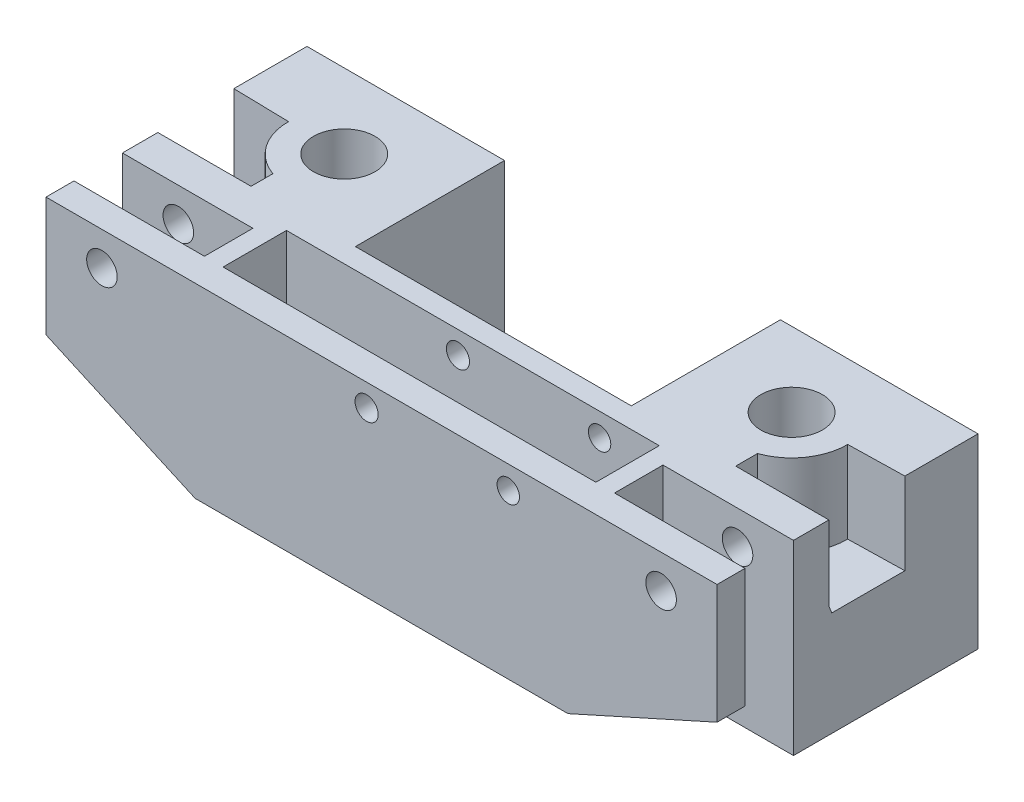
from build123d import *

# Parameters (mm, degrees)
SKETCH1_R               = 2.51
BOSS_EXTRUDE1_DEPTH     = 5
SKETCH2_R               = 6.125
SKETCH2_R_2             = 4.125
BOSS_EXTRUDE2_DEPTH     = 20
SKETCH1_3_W             = 20
SKETCH1_3_H             = 15
BOSS_EXTRUDE3_DEPTH     = 25
SKETCH3_W               = 17.5
SKETCH3_H               = 6.5
CUT_EXTRUDE2_DEPTH      = 21.5
CUT_EXTRUDE3_REACH      = 64.249
SKETCH4_R               = 2.05
SKETCH5_W               = 13.25
SKETCH5_H               = 9
CUT_EXTRUDE4_DEPTH      = 97.695397829
BOSS_EXTRUDE4_DEPTH     = 90
SKETCH9_R               = 1.5
CUT_EXTRUDE6_DEPTH      = 56.226804735
BOSS_EXTRUDE9_OUTLINE_W = 26.5
BOSS_EXTRUDE9_OUTLINE_H = 20
BOSS_EXTRUDE9_OUTLINE_R = 6.125
BOSS_EXTRUDE9_DEPTH     = 9
SKETCH12_R              = 7.5
SKETCH12_R_2            = 6.125
SKETCH12_W              = 5
SKETCH12_H              = 0.387499923
BOSS_EXTRUDE10_DEPTH    = 11
BOSS_EXTRUDE11_START    = -25
SKETCH13_W              = 50
SKETCH13_H              = 3.75
BOSS_EXTRUDE11_DEPTH    = 25
BOSS_EXTRUDE12_DEPTH    = 9
BOSS_EXTRUDE13_DEPTH    = 3.75
SKETCH16_R              = 1.55
SKETCH16_R_2            = 1.5
CUT_EXTRUDE7_DEPTH      = 38


# Read off the part's stored shape, not the designer's step: Boss-Extrude9
with BuildPart() as part:
    # Sketch1 → Boss-Extrude1 (new body)
    with BuildSketch(Plane(origin=(0, 0, 0), x_dir=(1, 0, 0), z_dir=(0, 1, 0))):
        with BuildLine():
            ThreePointArc((-2.51, -9.999999226), (0, -7.489999226), (2.51, -9.999999226))
            Line((2.51, -9.999999226), (45, -9.999999226))
            Line((45, -9.999999226), (45, 10.000000774))
            Line((45, 10.000000774), (2.51, 10.000000774))
            ThreePointArc((2.51, 10.000000774), (0, 7.490000774), (-2.51, 10.000000774))
            Line((-2.51, 10.000000774), (-45, 10.000000774))
            Line((-45, 10.000000774), (-45, -9.999999226))
            Line((-45, -9.999999226), (-2.51, -9.999999226))
        make_face()
        with BuildLine():
            ThreePointArc((-7.500032569, 0.22419454), (-10, -2.509999226), (-12.499967431, 0.22419454))
            ThreePointArc((-12.499967431, 0.22419454), (-10, 2.510000774), (-7.500032569, 0.22419454))
        make_face(mode=Mode.SUBTRACT)
        with BuildLine():
            ThreePointArc((2.499967431, 0.22419454), (0, -2.509999226), (-2.499967431, 0.22419454))
            ThreePointArc((-2.499967431, 0.22419454), (0, 2.510000774), (2.499967431, 0.22419454))
        make_face(mode=Mode.SUBTRACT)
        with Locations(Location((10, 7.74e-07, 0), (0, 0, 270))):
            Circle(SKETCH1_R, mode=Mode.SUBTRACT)
    extrude(amount=BOSS_EXTRUDE1_DEPTH)

    # Sketch2 → Boss-Extrude2 (add)
    # profile 1 of 2: a face of its own
    with BuildSketch(Plane(origin=(0, 5, 0), x_dir=(1, 0, 0), z_dir=(0, 1, 0))):
        with Locations(Location((-30, 0, 0), (0, 0, 270))):
            Circle(SKETCH2_R)
        with Locations(Location((-30, 0, 0), (0, 0, 270))):
            Circle(SKETCH2_R_2, mode=Mode.SUBTRACT)
    # profile 2 of 2: a face of its own
    with BuildSketch(Plane(origin=(0, 5, 0), x_dir=(1, 0, 0), z_dir=(0, 1, 0))):
        with Locations(Location((30, 0, 0), (0, 0, 270))):
            Circle(SKETCH2_R)
        with Locations(Location((30, 0, 0), (0, 0, 270))):
            Circle(SKETCH2_R_2, mode=Mode.SUBTRACT)
    extrude(amount=BOSS_EXTRUDE2_DEPTH)

    # Sketch1<3> → Boss-Extrude3 (add)
    with BuildSketch(Plane(origin=(0, 0, 0), x_dir=(1, 0, 0), z_dir=(0, 1, 0))):
        with Locations((35, -17.499999226)):
            Rectangle(SKETCH1_3_W, SKETCH1_3_H)
        with Locations((-35, -17.499999226)):
            Rectangle(SKETCH1_3_W, SKETCH1_3_H)
    extrude(amount=BOSS_EXTRUDE3_DEPTH)

    # Sketch3 → Cut-Extrude2 (cut)
    with BuildSketch(Plane(origin=(0, 25, 0), x_dir=(1, 0, 0), z_dir=(0, 1, 0))):
        with Locations((36.25, -17.999999226)):
            Rectangle(SKETCH3_W, SKETCH3_H)
        with Locations((-36.25, -17.999999226)):
            Rectangle(SKETCH3_W, SKETCH3_H)
    extrude(amount=-CUT_EXTRUDE2_DEPTH, mode=Mode.SUBTRACT)

    # Cut-Extrude3: up to this face of the body (flat: up to its plane)
    cut_extrude3_end = Plane(part.part.faces().sort_by_distance((35, 15, 9.999999226))[0])
    # Sketch4 → Cut-Extrude3 (cut, up to the picked face)
    with BuildSketch(Plane.XY.offset(24.999999226), mode=Mode.PRIVATE) as cut_extrude3_sk1:
        with Locations((37.5, 20.5)):
            Circle(SKETCH4_R)
    cut_extrude3_tool1 = split(extrude(cut_extrude3_sk1.sketch, amount=-CUT_EXTRUDE3_REACH, mode=Mode.PRIVATE), bisect_by=cut_extrude3_end, keep=Keep.BOTH, mode=Mode.PRIVATE)
    # Sketch4 → Cut-Extrude3 (cut, up to the picked face)
    with BuildSketch(Plane.XY.offset(24.999999226), mode=Mode.PRIVATE) as cut_extrude3_sk2:
        with Locations((-37.5, 20.5)):
            Circle(SKETCH4_R)
    cut_extrude3_tool2 = split(extrude(cut_extrude3_sk2.sketch, amount=-CUT_EXTRUDE3_REACH, mode=Mode.PRIVATE), bisect_by=cut_extrude3_end, keep=Keep.BOTH, mode=Mode.PRIVATE)
    add(cut_extrude3_tool1.solids().sort_by(Axis((37.5, 20.5, 24.999999), (0, 0, -1)))[0], mode=Mode.SUBTRACT)
    add(cut_extrude3_tool2.solids().sort_by(Axis((-37.5, 20.5, 24.999999), (0, 0, -1)))[0], mode=Mode.SUBTRACT)

    # Sketch5 → Cut-Extrude4 (cut, through all)
    with BuildSketch(Plane(origin=(45, 0, 0), x_dir=(0, 0, -1), z_dir=(1, 0, 0))):
        with Locations((-18.374999226, 4.5)):
            Rectangle(SKETCH5_W, SKETCH5_H)
    extrude(amount=-CUT_EXTRUDE4_DEPTH, mode=Mode.SUBTRACT)

    # Sketch6 → Boss-Extrude4 (add, through all)
    with BuildSketch(Plane(origin=(45, 0, 0), x_dir=(0, 0, -1), z_dir=(1, 0, 0))):
        Polygon((-9.999999226, 15), (-6.125, 5), (-9.999999226, 5), align=None)
    extrude(amount=-BOSS_EXTRUDE4_DEPTH)

    # Sketch9 → Cut-Extrude6 (cut, through all)
    with BuildSketch(Plane(origin=(0, 5, 0), x_dir=(1, 0, 0), z_dir=(0, 1, 0))):
        with Locations(Location((30, 0, 0), (0, 0, 270))):
            Circle(SKETCH9_R)
        with Locations(Location((-30, 0, 0), (0, 0, 270))):
            Circle(SKETCH9_R)
    extrude(amount=-CUT_EXTRUDE6_DEPTH, mode=Mode.SUBTRACT)

    # Boss-Extrude9 outline → Boss-Extrude9 (add)
    # profile 1 of 2: a face of its own
    with BuildSketch(Plane(origin=(0, 5, 0), x_dir=(1, 0, 0), z_dir=(0, 1, 0))):
        with Locations((-31.75, 7.74e-07)):
            Rectangle(BOSS_EXTRUDE9_OUTLINE_W, BOSS_EXTRUDE9_OUTLINE_H)
        with Locations((-30, 0)):
            Circle(BOSS_EXTRUDE9_OUTLINE_R, mode=Mode.SUBTRACT)
    # profile 2 of 2: a face of its own
    with BuildSketch(Plane(origin=(0, 5, 0), x_dir=(1, 0, 0), z_dir=(0, 1, 0))):
        with Locations((31.75, 7.74e-07)):
            Rectangle(BOSS_EXTRUDE9_OUTLINE_W, BOSS_EXTRUDE9_OUTLINE_H)
        with Locations((30, 0)):
            Circle(BOSS_EXTRUDE9_OUTLINE_R, mode=Mode.SUBTRACT)
    extrude(amount=BOSS_EXTRUDE9_DEPTH)

    # Sketch12 → Boss-Extrude10 (add)
    # profile 1 of 8: a face of its own
    with BuildSketch(Plane(origin=(0, 14, 0), x_dir=(1, 0, 0), z_dir=(0, 1, 0))):
        with BuildLine():
            Line((32.5, -9.612499303), (32.5, -7.071067812))
            ThreePointArc((32.5, -7.071067812), (30, -7.5), (27.5, -7.071067812))
            Line((27.5, -7.071067812), (27.5, -9.612499303))
            Line((27.5, -9.612499303), (32.5, -9.612499303))
        make_face()
    # profile 2 of 8: a face of its own
    with BuildSketch(Plane(origin=(0, 14, 0), x_dir=(1, 0, 0), z_dir=(0, 1, 0))):
        with Locations((30, 0)):
            Circle(SKETCH12_R)
        with Locations((30, 0)):
            Circle(SKETCH12_R_2, mode=Mode.SUBTRACT)
    # profile 3 of 8: a face of its own
    with BuildSketch(Plane(origin=(0, 14, 0), x_dir=(1, 0, 0), z_dir=(0, 1, 0))):
        with BuildLine():
            Line((-32.5, -7.071067812), (-32.5, -9.999999226))
            Line((-32.5, -9.999999226), (-27.5, -9.999999226))
            Line((-27.5, -9.999999226), (-27.5, -7.071067812))
            ThreePointArc((-27.5, -7.071067812), (-30, -7.5), (-32.5, -7.071067812))
        make_face()
    # profile 4 of 8: a face of its own
    with BuildSketch(Plane(origin=(0, 14, 0), x_dir=(1, 0, 0), z_dir=(0, 1, 0))):
        with Locations((-30, 0)):
            Circle(SKETCH12_R)
        with Locations((-30, 0)):
            Circle(SKETCH12_R_2, mode=Mode.SUBTRACT)
    # profile 5 of 8: a face of its own
    with BuildSketch(Plane(origin=(0, 14, 0), x_dir=(1, 0, 0), z_dir=(0, 1, 0))):
        with Locations((30, -9.806249264)):
            Rectangle(SKETCH12_W, SKETCH12_H)
    # profile 6 of 8: a face of its own
    with BuildSketch(Plane(origin=(0, 14, 0), x_dir=(1, 0, 0), z_dir=(0, 1, 0))):
        with BuildLine():
            Line((27.5, -9.612499303), (27.5, -7.071067812))
            ThreePointArc((27.5, -7.071067812), (25.657627479, 6.115047088), (37.499939934, 0.030016408))
            Line((37.499939934, 0.030016408), (45, 0.193750736))
            Line((45, 0.193750736), (45, 10.000000774))
            Line((45, 10.000000774), (18.5, 10.000000774))
            Line((18.5, 10.000000774), (18.5, -9.612499303))
            Line((18.5, -9.612499303), (27.5, -9.612499303))
        make_face()
    # profile 7 of 8: a face of its own
    with BuildSketch(Plane(origin=(0, 14, 0), x_dir=(1, 0, 0), z_dir=(0, 1, 0))):
        with BuildLine():
            Line((-27.5, -7.071067812), (-27.5, -9.999999226))
            Line((-27.5, -9.999999226), (-25, -9.999999226))
            Line((-25, -9.999999226), (-18.5, -9.999999226))
            Line((-18.5, -9.999999226), (-18.5, -9.612499303))
            Line((-18.5, -9.612499303), (-18.5, 10.000000774))
            Line((-18.5, 10.000000774), (-45, 10.000000774))
            Line((-45, 10.000000774), (-45, 0.193750736))
            Line((-45, 0.193750736), (-37.499939934, 0.030016408))
            ThreePointArc((-37.499939934, 0.030016408), (-29.984991766, 7.499984984), (-22.5, 0))
            ThreePointArc((-22.5, 0), (-23.876275643, -4.330127019), (-27.5, -7.071067812))
        make_face()
    # profile 8 of 8: a face of its own
    with BuildSketch(Plane(origin=(0, 14, 0), x_dir=(1, 0, 0), z_dir=(0, 1, 0))):
        Polygon((27.5, -9.999999226), (27.5, -9.612499303), (18.5, -9.612499303), (18.5, -9.999999226), (25, -9.999999226), align=None)
    extrude(amount=BOSS_EXTRUDE10_DEPTH)

    # Sketch13 → Boss-Extrude11 (add)
    with BuildSketch(Plane(origin=(0, 25, 0), x_dir=(1, 0, 0), z_dir=(0, 1, 0)).offset(BOSS_EXTRUDE11_START)):
        with Locations((0, -23.124999226)):
            Rectangle(SKETCH13_W, SKETCH13_H)
        Polygon((25, -12.749999226), (25, -9.999999226), (18.5, -9.999999226), (-25, -9.999999226), (-25, -12.749999226), align=None)
    extrude(amount=BOSS_EXTRUDE11_DEPTH)

    # Sketch14 → Boss-Extrude12 (add)
    with BuildSketch(Plane.XZ.offset(-9)):
        Polygon((-25, 14.749999226), (-27.5, 14.749999226), (-45, 14.749999226), (-45, 11.749999226), (-25, 11.749999226), (-25, 12.749999226), align=None)
        Polygon((45, 14.749999226), (27.5, 14.749999226), (25, 14.749999226), (25, 12.749999226), (25, 11.749999226), (45, 11.749999226), align=None)
    extrude(amount=BOSS_EXTRUDE12_DEPTH)

    # Sketch15 → Boss-Extrude13 (add)
    with BuildSketch(Plane.XY.offset(24.999999226)):
        Polygon((-45, 9), (-25, 0), (-25, 9), align=None)
        Polygon((25, 0), (45, 9), (25, 9), align=None)
    extrude(amount=-BOSS_EXTRUDE13_DEPTH)

    # Sketch16 → Cut-Extrude7 (cut)
    with BuildSketch(Plane.XY.offset(24.999999226)):
        with Locations((-1.99973684, 22)):
            Circle(SKETCH16_R)
        with Locations((17, 21.9)):
            Circle(SKETCH16_R_2)
    extrude(amount=-CUT_EXTRUDE7_DEPTH, mode=Mode.SUBTRACT)


solid = part.part
